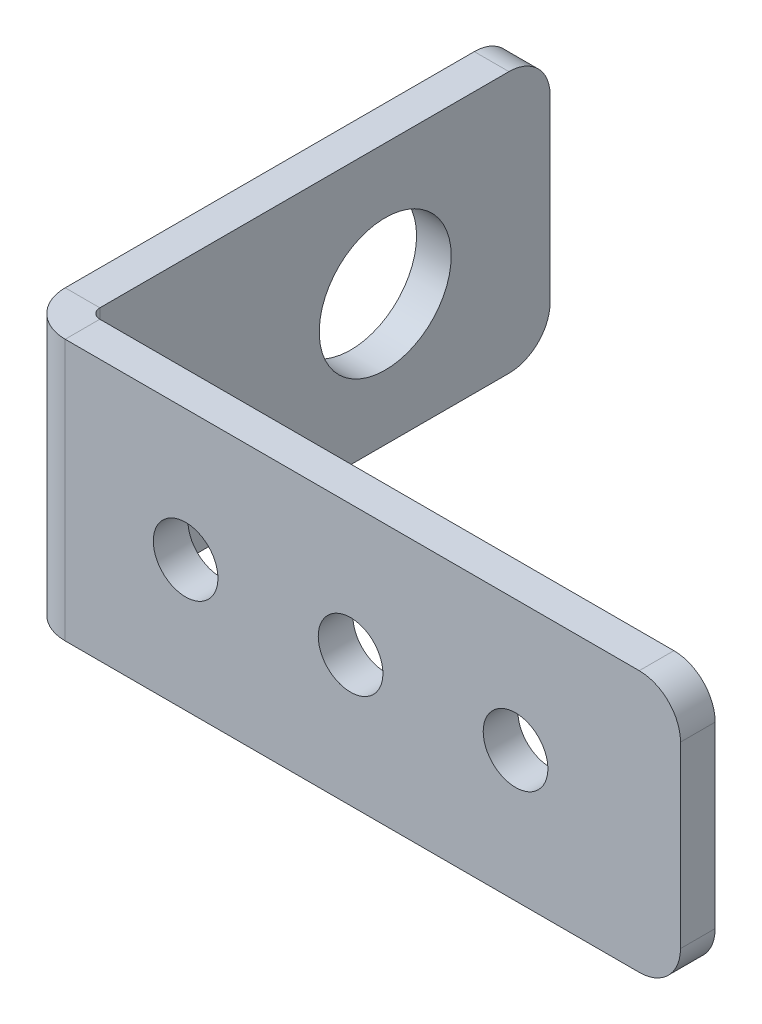
from build123d import *

# Parameters (mm, degrees)
BASE_FLANGE1_DEPTH = 20.1168
SKETCH6_R          = 2.4892
CUT_EXTRUDE1_DEPTH = 66.121602646
SKETCH7_R          = 5.08
CUT_EXTRUDE2_DEPTH = 65.599391106
FILLET1_R          = 3.175


# Read off the part's stored shape, not the designer's step: Base-Flange1
with BuildPart() as part:
    # Base-Flange1 outline → Base-Flange1 (new body)
    with BuildSketch(Plane(origin=(0, 0, 0), x_dir=(1, 0, 0), z_dir=(0, 1, 0))):
        with BuildLine():
            Line((3.429, 0), (50.8, 0))
            Line((50.8, 0), (50.8, 2.667))
            Line((50.8, 2.667), (3.429, 2.667))
            ThreePointArc((3.429, 2.667), (2.890184633, 2.890184633), (2.667, 3.429))
            Line((2.667, 3.429), (2.667, 38.1))
            Line((2.667, 38.1), (0, 38.1))
            Line((0, 38.1), (0, 3.429))
            ThreePointArc((0, 3.429), (1.004330847, 1.004330847), (3.429, 0))
        make_face()
    extrude(amount=BASE_FLANGE1_DEPTH)

    # Sketch6 → Cut-Extrude1 (cut, through all)
    with BuildSketch(Plane(origin=(0, 0, -2.667), x_dir=(-1, 0, 0), z_dir=(0, 0, -1))):
        with Locations((-38.1, 10.0584)):
            Circle(SKETCH6_R)
        with Locations((-25.4, 10.0584)):
            Circle(SKETCH6_R)
        with Locations((-12.7, 10.0584)):
            Circle(SKETCH6_R)
    extrude(amount=-CUT_EXTRUDE1_DEPTH, mode=Mode.SUBTRACT)

    # Sketch7 → Cut-Extrude2 (cut, through all)
    with BuildSketch(Plane(origin=(2.667, 0, 0), x_dir=(0, 0, -1), z_dir=(1, 0, 0))):
        with Locations((25.4, 10.0584)):
            Circle(SKETCH7_R)
    extrude(amount=-CUT_EXTRUDE2_DEPTH, mode=Mode.SUBTRACT)

    # Fillet1
    fillet1_edges = [part.edges().sort_by_distance(p)[0] for p in [
        (1.3335, 20.1168, -38.1),
        (1.3335, 0, -38.1),
        (50.8, 20.1168, -1.3335),
        (50.8, 0, -1.3335),
    ]]
    fillet(fillet1_edges, radius=FILLET1_R)


solid = part.part
